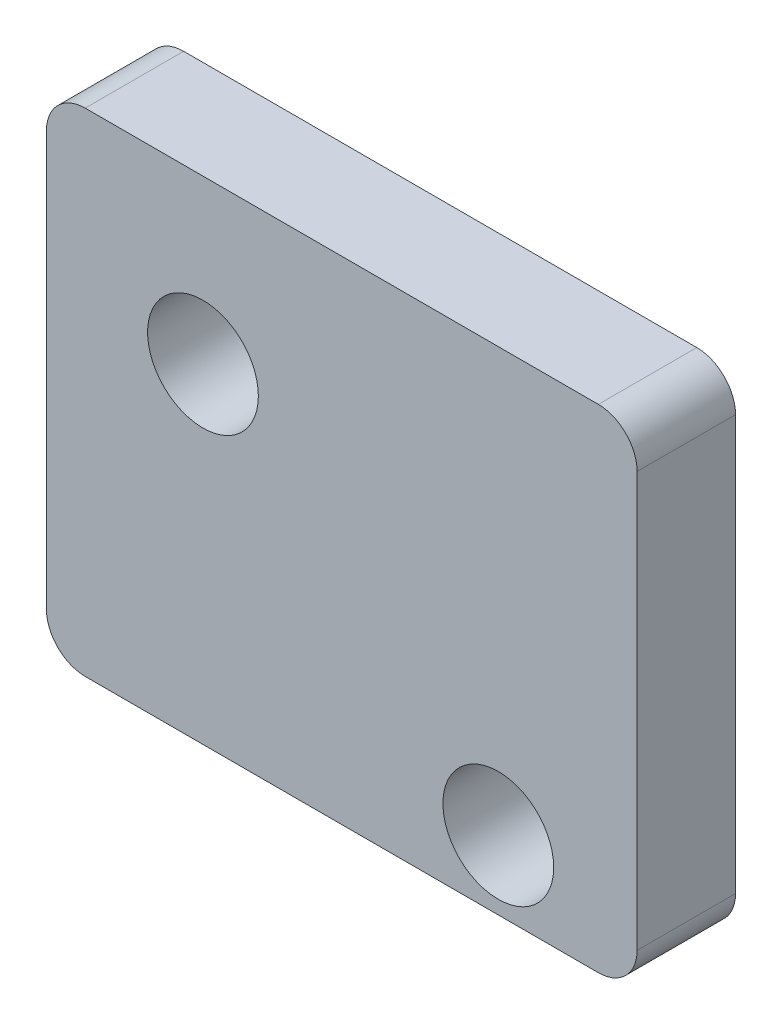
from build123d import *

# Parameters (mm, degrees)
SKETCH2_W           = 152.4
SKETCH2_H           = 127
SKETCH2_R           = 14.2875
BOSS_EXTRUDE1_DEPTH = 25.4
FILLET2_R           = 10


with BuildPart() as part:
    # Sketch2 → Boss-Extrude1 (new body)
    with BuildSketch(Plane.XY):
        with Locations((76.2, -63.5)):
            Rectangle(SKETCH2_W, SKETCH2_H)
        with Locations((40.386032851, -42.017916699)):
            Circle(SKETCH2_R, mode=Mode.SUBTRACT)
        with Locations((116.586032851, -109.22)):
            Circle(SKETCH2_R, mode=Mode.SUBTRACT)
    extrude(amount=BOSS_EXTRUDE1_DEPTH)

    # Fillet2
    fillet2_edges = [part.edges().sort_by_distance(p)[0] for p in [
        (152.4, 0, 12.7),
        (152.4, -127, 12.7),
        (0, -127, 12.7),
        (0, 0, 12.7),
    ]]
    fillet(fillet2_edges, radius=FILLET2_R)


solid = part.part
